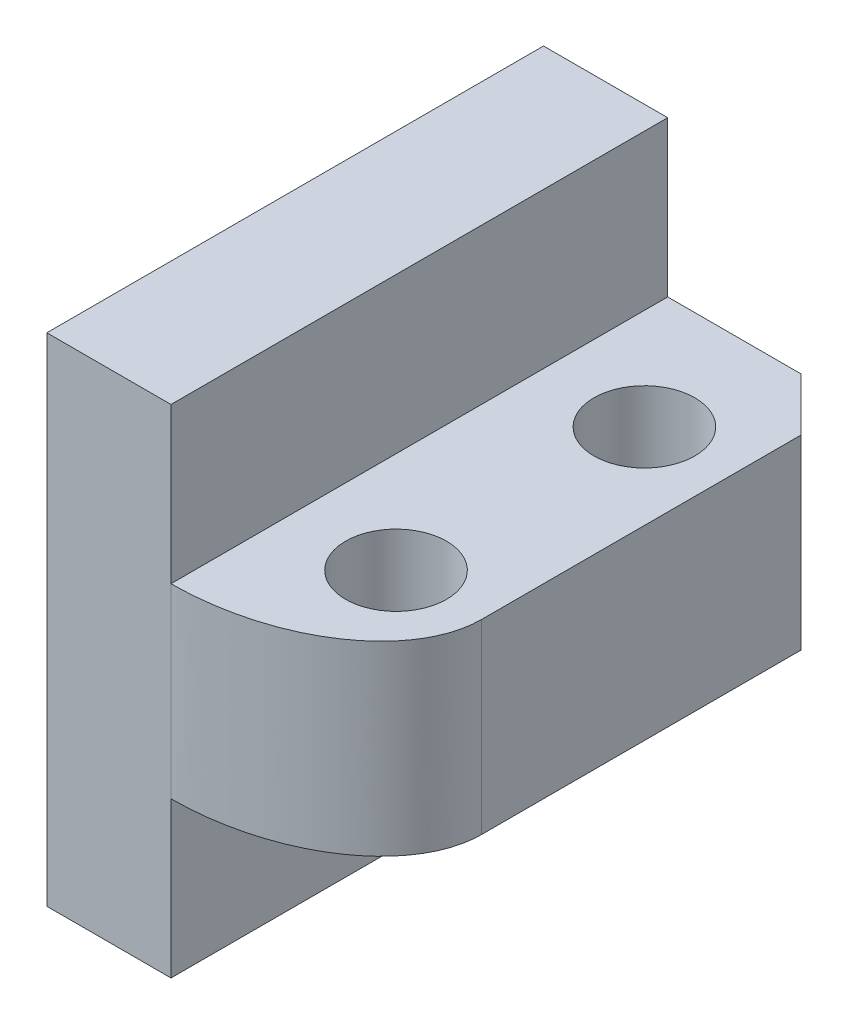
from build123d import *

# Parameters (mm, degrees)
BOSS_EXTRUDE1_DEPTH = 16
SKETCH2_R           = 1.625
CUT_EXTRUDE1_DEPTH  = 21.322401433
CHAMFER1_SIZE       = 1.7
FILLET1_SIZE        = 4
FILLET1_SIZE_2      = 6


with BuildPart() as part:
    # Sketch1 → Boss-Extrude1 (new body)
    with BuildSketch(Plane.XY):
        Polygon((-4, -8), (-4, 8), (0, 8), (0, 3), (6, 3), (6, -3), (0, -3), (0, -8), align=None)
    extrude(amount=BOSS_EXTRUDE1_DEPTH)

    # Sketch2 → Cut-Extrude1 (cut, through all)
    with BuildSketch(Plane.XZ.offset(3)):
        with Locations(Location((3.25, 12, 0), (0, 0, 270))):
            Circle(SKETCH2_R)
        with Locations(Location((3.25, 4, 0), (0, 0, 270))):
            Circle(SKETCH2_R)
    extrude(amount=-CUT_EXTRUDE1_DEPTH, mode=Mode.SUBTRACT)

    # Chamfer1
    chamfer1_edges = [part.edges().sort_by_distance(p)[0] for p in [
        (6, 0, 0),
    ]]
    chamfer(chamfer1_edges, length=CHAMFER1_SIZE)

    # Fillet1
    # an asymmetric fillet: 6, 4 mm, written as the material it takes off along each edge
    with BuildSketch(Plane(origin=(6, 18, 16), x_dir=(0, 0, -1), z_dir=(0, -1, 0))) as fillet1_piece_1:
        with BuildLine():
            Bezier((FILLET1_SIZE, 0), (0, 0), (0, -FILLET1_SIZE_2), weights=[1, 0.707106781, 1])
            Line((0, -FILLET1_SIZE_2), (0, 0))
            Line((0, 0), (FILLET1_SIZE, 0))
        make_face()
    extrude(amount=36, mode=Mode.SUBTRACT)


solid = part.part
